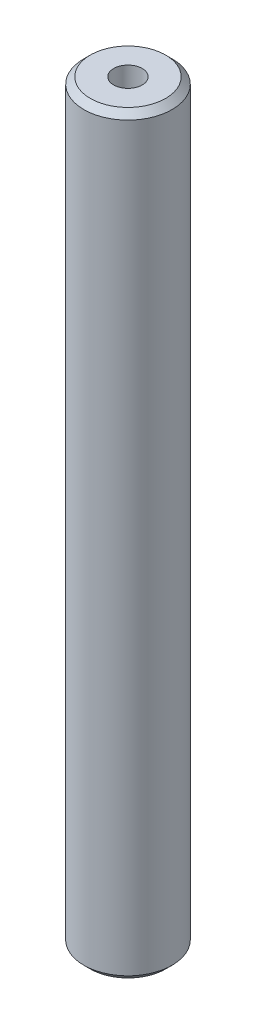
from build123d import *

# Parameters (mm, degrees)
SKETCH1_R           = 7.5
BOSS_EXTRUDE1_DEPTH = 128.302054556
SKETCH2_R           = 2.433378273
CUT_EXTRUDE1_DEPTH  = 129.739726593
CHAMFER1_SIZE       = 1.095119868


with BuildPart() as part:
    # Sketch1 → Boss-Extrude1 (new body)
    with BuildSketch(Plane(origin=(0, 0, 0), x_dir=(1, 0, 0), z_dir=(0, 1, 0))):
        Circle(SKETCH1_R)
    extrude(amount=BOSS_EXTRUDE1_DEPTH)

    # Sketch2 → Cut-Extrude1 (cut, through all)
    with BuildSketch(Plane(origin=(0, 0, 0), x_dir=(1, 0, 0), z_dir=(0, 1, 0))):
        Circle(SKETCH2_R)
    extrude(amount=CUT_EXTRUDE1_DEPTH, mode=Mode.SUBTRACT)

    # Chamfer1
    chamfer1_edges = [part.edges().sort_by_distance(p)[0] for p in [
        (-7.5, 128.302054556, 0),
        (-7.5, 0, 0),
    ]]
    chamfer(chamfer1_edges, length=CHAMFER1_SIZE)


solid = part.part
